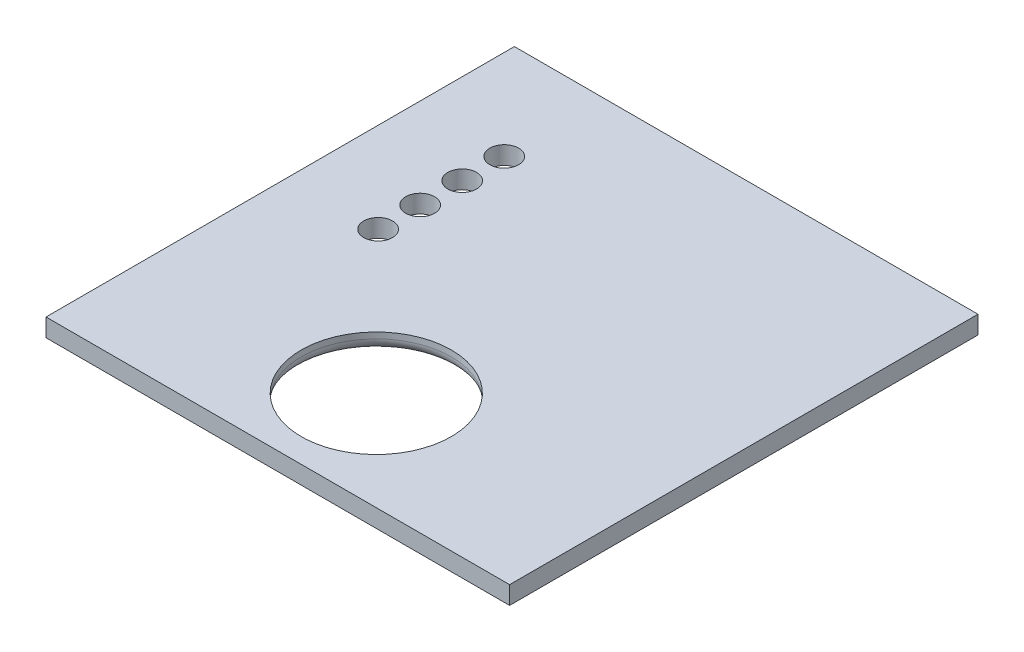
from build123d import *

# Parameters (mm, degrees)
SKETCH_1_W                = 77.2
SKETCH_1_H                = 78
EXTRUDE_1_DEPTH           = 3
CUT_EXTRUDE_1_DEPTH       = 87
CUT_EXTRUDE_1_DEPTH_BACK  = 71
SKETCH_2_R                = 9.75
CUT_EXTRUDE_3_DEPTH       = 150
CUT_EXTRUDE_3_DEPTH_BACK  = 207
SKETCH_3_R                = 2.4
SKETCH_11_W               = 34.361209151
SKETCH_11_H               = 23.148078535
EXTRUDE_4_DEPTH           = 3
CUT_EXTRUDE_10_DEPTH      = 17
CUT_EXTRUDE_10_DEPTH_BACK = 10
SKETCH_13_R               = 12
CHAMFER_4_SIZE            = 6
SKETCH_14_W               = 38.187974991
SKETCH_14_H               = 34.221306214
EXTRUDE_5_DEPTH           = 3
CUT_EXTRUDE_11_DEPTH      = 644
CUT_EXTRUDE_11_DEPTH_BACK = 12256
SKETCH_15_R               = 12.5
EXTRUDE_6_DEPTH           = 1
EXTRUDE_6_DEPTH_BACK      = 3
SKETCH_16_W               = 18.047356328
SKETCH_16_H               = 3.010605737
SKETCH_17_W               = 19.670999845
SKETCH_17_H               = 3.661099776
CUT_EXTRUDE_12_DEPTH      = 1
FILLET_1_R                = 2


with BuildPart() as part:
    # Эскиз1 → Бобышка-Вытянуть1 (new body)
    with BuildSketch(Plane(origin=(0, 0, 0), x_dir=(1, 0, 0), z_dir=(0, 1, 0))):
        with Locations((-119.576362238, 47.549210869)):
            Rectangle(SKETCH_1_W, SKETCH_1_H)
    extrude(amount=EXTRUDE_1_DEPTH)

    # Эскиз2 → Вырез-Вытянуть1 (cut, two sides: drawn at the far end of the back side and taken through both)
    with BuildSketch(Plane(origin=(0, 3, 0), x_dir=(1, 0, 0), z_dir=(0, 1, 0)).offset(-CUT_EXTRUDE_1_DEPTH_BACK)):
        with Locations(Location((-119.576362238, 22.549210869, 0), (0, 0, 270))):
            Circle(SKETCH_2_R)
    extrude(amount=CUT_EXTRUDE_1_DEPTH + CUT_EXTRUDE_1_DEPTH_BACK, mode=Mode.SUBTRACT)

    # Эскиз3 → Вырез-Вытянуть3 (cut, two sides: drawn at the far end of the back side and taken through both)
    with BuildSketch(Plane(origin=(0, 3, 0), x_dir=(1, 0, 0), z_dir=(0, 1, 0)).offset(-CUT_EXTRUDE_3_DEPTH_BACK)):
        with Locations(Location((-143.176362238, 69.855558065, 0), (0, 0, 270))):
            Circle(SKETCH_3_R)
        with Locations(Location((-143.176362238, 62.855558065, 0), (0, 0, 270))):
            Circle(SKETCH_3_R)
        with Locations(Location((-143.176362238, 55.855558065, 0), (0, 0, 270))):
            Circle(SKETCH_3_R)
        with Locations(Location((-143.176362238, 48.855558065, 0), (0, 0, 270))):
            Circle(SKETCH_3_R)
    extrude(amount=CUT_EXTRUDE_3_DEPTH + CUT_EXTRUDE_3_DEPTH_BACK, mode=Mode.SUBTRACT)

    # Эскиз11 → Бобышка-Вытянуть4 (add)
    with BuildSketch(Plane.XZ):
        with Locations((-119.254790978, -23.284724875)):
            Rectangle(SKETCH_11_W, SKETCH_11_H)
    extrude(amount=-EXTRUDE_4_DEPTH)

    # Эскиз13 → Вырез-Вытянуть10 (cut, two sides: drawn at the far end of the back side and taken through both)
    with BuildSketch(Plane(origin=(0, 3, 0), x_dir=(1, 0, 0), z_dir=(0, 1, 0)).offset(-CUT_EXTRUDE_10_DEPTH_BACK)):
        with Locations(Location((-119.676362238, 27.549210869, 0), (0, 0, 270))):
            Circle(SKETCH_13_R)
    extrude(amount=CUT_EXTRUDE_10_DEPTH + CUT_EXTRUDE_10_DEPTH_BACK, mode=Mode.SUBTRACT)

    # Фаска4
    # the kernel refuses this chamfer: 6 mm, written as the material it takes off along each edge
    with BuildSketch(Plane(origin=(-119.676362238, 0, -27.549210869), x_dir=(0, 0, 1), z_dir=(-1, 0, 0))) as chamfer_4_piece_1:
        Polygon((12 + CHAMFER_4_SIZE, 0), (12, CHAMFER_4_SIZE), (12, 0), align=None)
    revolve(axis=Axis((-119.676362238, 0, -27.549210869), (0, 1, 0)), mode=Mode.SUBTRACT)

    # Эскиз14 → Бобышка-Вытянуть5 (add)
    with BuildSketch(Plane(origin=(0, 3, 0), x_dir=(1, 0, 0), z_dir=(0, 1, 0))):
        with Locations((-119.593003147, 28.62902577)):
            Rectangle(SKETCH_14_W, SKETCH_14_H)
    extrude(amount=-EXTRUDE_5_DEPTH)

    # Эскиз15 → Вырез-Вытянуть11 (cut, two sides: drawn at the far end of the back side and taken through both)
    with BuildSketch(Plane(origin=(0, 3, 0), x_dir=(1, 0, 0), z_dir=(0, 1, 0)).offset(-CUT_EXTRUDE_11_DEPTH_BACK)):
        with Locations(Location((-119.676362238, 25.049210869, 0), (0, 0, 90))):
            Circle(SKETCH_15_R)
    extrude(amount=CUT_EXTRUDE_11_DEPTH + CUT_EXTRUDE_11_DEPTH_BACK, mode=Mode.SUBTRACT)

    # Эскиз16 → Бобышка-Вытянуть6 (add, two sides: drawn at the far end of the back side and taken through both)
    with BuildSketch(Plane.XZ.offset(-EXTRUDE_6_DEPTH_BACK)):
        with Locations((-119.464156945, -10.715514892)):
            Rectangle(SKETCH_16_W, SKETCH_16_H)
    extrude(amount=EXTRUDE_6_DEPTH + EXTRUDE_6_DEPTH_BACK)

    # Эскиз17 → Вырез-Вытянуть12 (cut)
    with BuildSketch(Plane(origin=(0, 0, 0), x_dir=(-1, 0, 0), z_dir=(0, -1, 0))):
        with Locations((119.795379251, 10.745864147)):
            Rectangle(SKETCH_17_W, SKETCH_17_H)
    extrude(amount=CUT_EXTRUDE_12_DEPTH, mode=Mode.SUBTRACT)

    # Скругление1
    fillet_1_edges = [part.edges().sort_by_distance(p)[0] for p in [
        (-119.676362238, 0, -12.549210869),
    ]]
    fillet(fillet_1_edges, radius=FILLET_1_R)


solid = part.part
